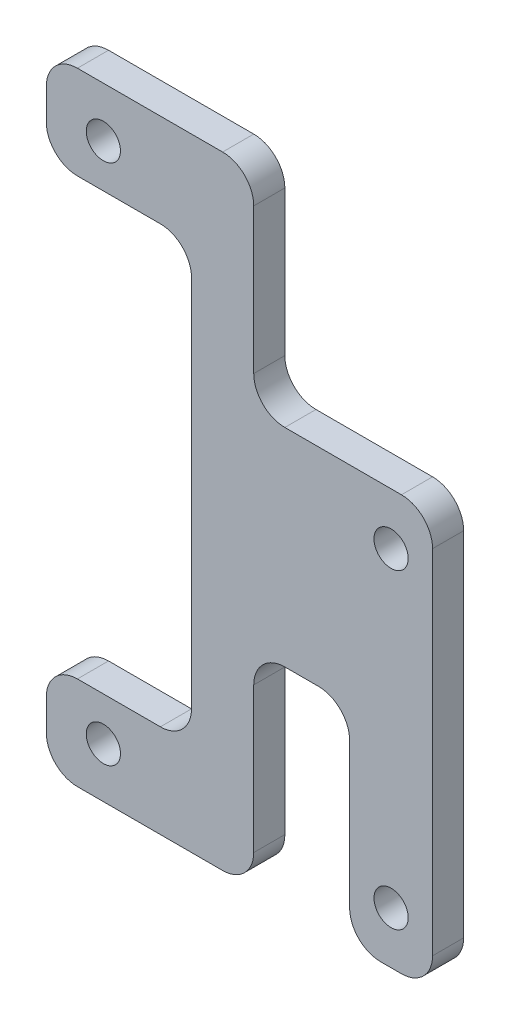
from build123d import *

# Parameters (mm, degrees)
SKETCH1_W           = 8
SKETCH1_H           = 40
SKETCH1_R           = 1.65
BOSS_EXTRUDE1_DEPTH = 3
SKETCH9_W           = 3
SKETCH9_H           = 20
BOSS_EXTRUDE6_DEPTH = 9.245
SKETCH10_W          = 3
SKETCH10_H          = 60
BOSS_EXTRUDE7_DEPTH = 20
SKETCH11_W          = 14
SKETCH11_H          = 42
CUT_EXTRUDE1_DEPTH  = 10
SKETCH12_R          = 1.65
CUT_EXTRUDE2_DEPTH  = 10
FILLET7_R           = 3


with BuildPart() as part:
    # Sketch1 → Boss-Extrude1 (new body)
    with BuildSketch(Plane.XY):
        Rectangle(SKETCH1_W, SKETCH1_H)
        with Locations((0, 15)):
            Circle(SKETCH1_R, mode=Mode.SUBTRACT)
        with Locations((0, -15)):
            Circle(SKETCH1_R, mode=Mode.SUBTRACT)
    extrude(amount=BOSS_EXTRUDE1_DEPTH)

    # Sketch9 → Boss-Extrude6 (add)
    with BuildSketch(Plane.ZY.offset(4)):
        with Locations((1.5, 10)):
            Rectangle(SKETCH9_W, SKETCH9_H)
    extrude(amount=BOSS_EXTRUDE6_DEPTH)

    # Sketch10 → Boss-Extrude7 (add)
    with BuildSketch(Plane.ZY.offset(13.245)):
        with Locations((1.5, 10)):
            Rectangle(SKETCH10_W, SKETCH10_H)
    extrude(amount=BOSS_EXTRUDE7_DEPTH)

    # Sketch11 → Cut-Extrude1 (cut)
    with BuildSketch(Plane.XY.offset(3)):
        with Locations((-26.245, 10)):
            Rectangle(SKETCH11_W, SKETCH11_H)
    extrude(amount=-CUT_EXTRUDE1_DEPTH, mode=Mode.SUBTRACT)

    # Sketch12 → Cut-Extrude2 (cut)
    with BuildSketch(Plane.XY.offset(3)):
        with Locations((-27.745, 35.17)):
            Circle(SKETCH12_R)
        with Locations((-27.745, -15.17)):
            Circle(SKETCH12_R)
    extrude(amount=-CUT_EXTRUDE2_DEPTH, mode=Mode.SUBTRACT)

    # Fillet7
    fillet7_edges = [part.edges().sort_by_distance(p)[0] for p in [
        (4, -20, 1.5),
        (-4, -20, 1.5),
        (-4, 0, 1.5),
        (-13.245, 0, 1.5),
        (-13.245, -20, 1.5),
        (-33.245, -20, 1.5),
        (-33.245, -11, 1.5),
        (-19.245, -11, 1.5),
        (4, 20, 1.5),
        (-13.245, 20, 1.5),
        (-13.245, 40, 1.5),
        (-19.245, 31, 1.5),
        (-33.245, 31, 1.5),
        (-33.245, 40, 1.5),
    ]]
    fillet(fillet7_edges, radius=FILLET7_R)


solid = part.part
